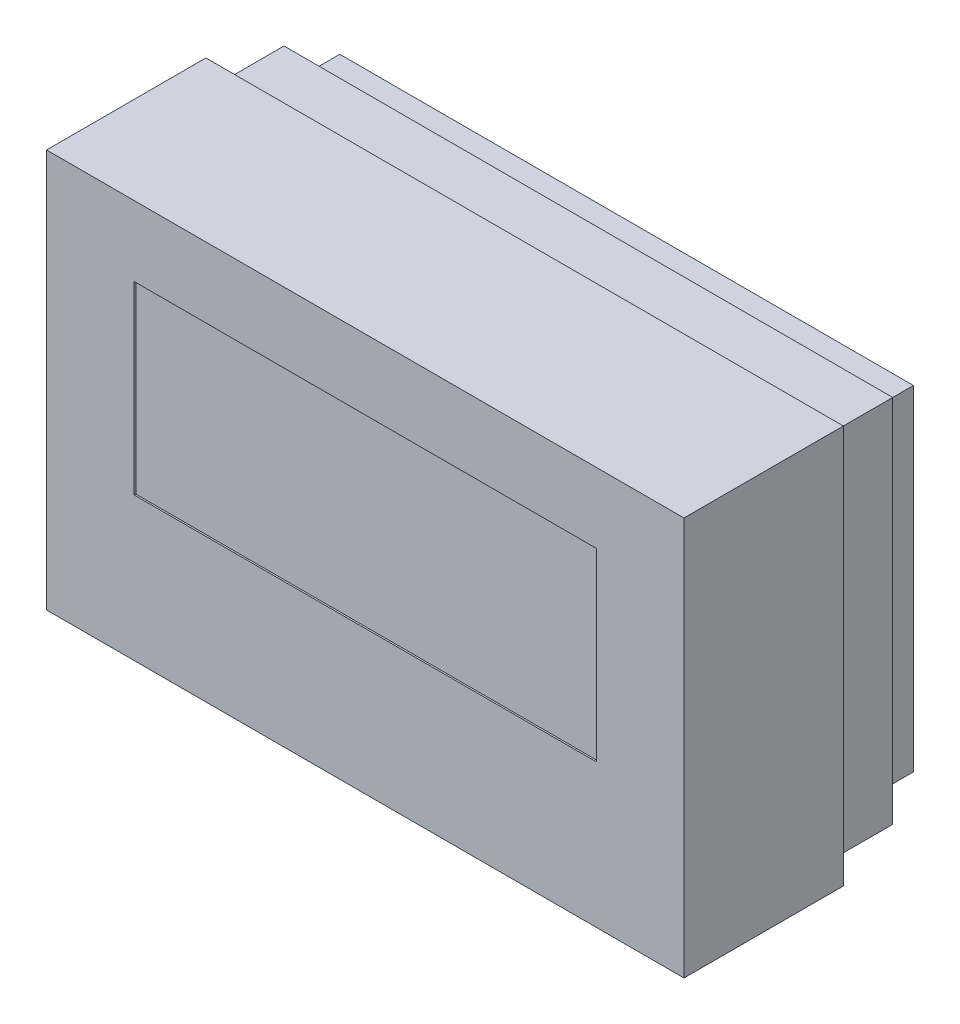
from build123d import *

# Parameters (mm, degrees)
SKETCH1_W                       = 40
SKETCH1_H                       = 25
BOSS_EXTRUDE1_DEPTH             = 10
SKETCH2_W                       = 29
SKETCH2_H                       = 11.6
CUT_EXTRUDE1_DEPTH              = 0.1
SKETCH4_W                       = 38.2
SKETCH4_H                       = 23.2
BOSS_EXTRUDE2_DEPTH             = 4
SKETCH5_W                       = 36
SKETCH5_H                       = 21
BOSS_EXTRUDE3_DEPTH             = 2.4
BOSS_EXTRUDE5_DEPTH             = 2.8
BOSS_EXTRUDE5_DIRECTION_2_REACH = 34.876
FILLET1_R                       = 2


with BuildPart() as part:
    # Sketch1 → Boss-Extrude1 (new body)
    with BuildSketch(Plane.XY):
        Rectangle(SKETCH1_W, SKETCH1_H)
    extrude(amount=BOSS_EXTRUDE1_DEPTH)

    # Sketch2 → Cut-Extrude1 (cut)
    with BuildSketch(Plane.XY.offset(10)):
        with Locations((0, 2.3)):
            Rectangle(SKETCH2_W, SKETCH2_H)
    extrude(amount=-CUT_EXTRUDE1_DEPTH, mode=Mode.SUBTRACT)

    # Sketch4 → Boss-Extrude2 (add)
    with BuildSketch(Plane(origin=(0, 0, 0), x_dir=(-1, 0, 0), z_dir=(0, 0, -1))):
        Rectangle(SKETCH4_W, SKETCH4_H)
    extrude(amount=BOSS_EXTRUDE2_DEPTH)

    # Sketch5 → Boss-Extrude3 (add)
    with BuildSketch(Plane(origin=(0, 0, -4), x_dir=(-1, 0, 0), z_dir=(0, 0, -1))):
        Rectangle(SKETCH5_W, SKETCH5_H)
    extrude(amount=BOSS_EXTRUDE3_DEPTH)

    # Sketch7 → Boss-Extrude5 (add)
    with BuildSketch(Plane.XZ.offset(11.6)):
        Polygon((14.5, 0), (9.5, -5), (-4.5, -5), (-9.5, 0), align=None)
    extrude(amount=BOSS_EXTRUDE5_DEPTH)

    # Boss-Extrude5 direction 2: up to this face of the body (flat: up to its plane)
    boss_extrude5_direction_2_end = Plane(part.part.faces().sort_by_distance((0, -10.5, -5.2))[0])
    # Sketch7 → Boss-Extrude5 direction 2 (add, up to the picked face)
    with BuildSketch(Plane.XZ.offset(11.6), mode=Mode.PRIVATE) as boss_extrude5_direction_2_sk1:
        Polygon((14.5, 0), (9.5, -5), (-4.5, -5), (-9.5, 0), align=None)
    boss_extrude5_direction_2_tool1 = split(extrude(boss_extrude5_direction_2_sk1.sketch, amount=-BOSS_EXTRUDE5_DIRECTION_2_REACH, mode=Mode.PRIVATE), bisect_by=boss_extrude5_direction_2_end, keep=Keep.BOTH, mode=Mode.PRIVATE)
    add(boss_extrude5_direction_2_tool1.solids().sort_by(Axis((2.5, -11.6, -2.280702), (0, 1, 0)))[0])

    # Fillet1
    # the kernel refuses this fillet: 2 mm, written as the material it takes off along each edge
    with BuildSketch(Plane(origin=(-14.493746089, -14.4, 0), x_dir=(0, 1, 0), z_dir=(1, 0, 0))) as fillet1_piece_1:
        with BuildLine():
            CenterArc((2, -1.997498436), FILLET1_R, 92.865983983, 87.134016017)
            Line((0, -1.997498436), (-0.04, -1.997498436))
            Line((-0.04, -1.997498436), (-0.04, 0))
            Line((-0.04, 0), (0, 0.04))
            ThreePointArc((0, 0.04), (0.95, 0.04), (1.898, 0.039949969))
            Line((1.898, 0.039949969), (1.9, 0))
        make_face()
    extrude(amount=33.987492178, mode=Mode.SUBTRACT)
    with BuildSketch(Plane(origin=(14.5, -14.4, -5), x_dir=(0, 1, 0), z_dir=(-1, 0, 0))) as fillet1_piece_2:
        with BuildLine():
            CenterArc((FILLET1_R, -FILLET1_R), FILLET1_R, 90, 90)
            Line((0, -FILLET1_R), (-FILLET1_R * 0.02, -FILLET1_R))
            Line((-FILLET1_R * 0.02, -FILLET1_R), (-FILLET1_R * 0.02, FILLET1_R * 0.02))
            Line((-FILLET1_R * 0.02, FILLET1_R * 0.02), (FILLET1_R, FILLET1_R * 0.02))
            Line((FILLET1_R, FILLET1_R * 0.02), (FILLET1_R, 0))
        make_face()
    extrude(amount=24, mode=Mode.SUBTRACT)


solid = part.part
